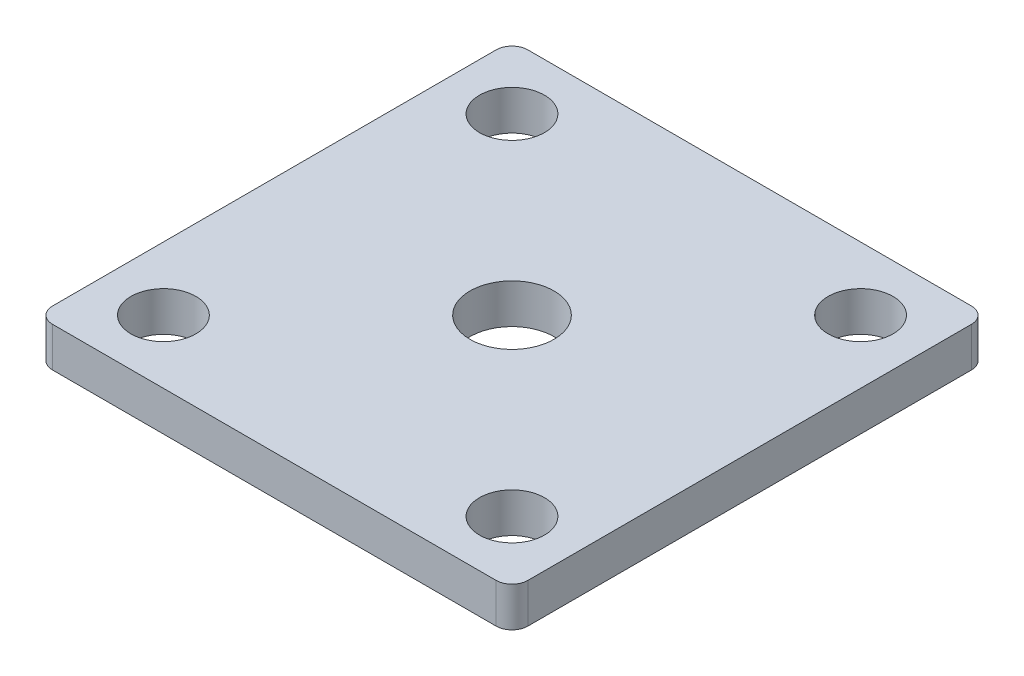
from build123d import *

# Parameters (mm, degrees)
SKETCH2_W           = 38.1
SKETCH2_H           = 38.1
SKETCH2_R           = 2.6035
SKETCH2_R_2         = 3.3655
BOSS_EXTRUDE1_DEPTH = 3.175
FILLET1_R           = 1.27


with BuildPart() as part:
    # Sketch2 → Boss-Extrude1 (new body)
    with BuildSketch(Plane(origin=(0, 0, 0), x_dir=(1, 0, 0), z_dir=(0, 1, 0))):
        Rectangle(SKETCH2_W, SKETCH2_H)
        with Locations((-13.97, 13.97)):
            Circle(SKETCH2_R, mode=Mode.SUBTRACT)
        with Locations((-13.97, -13.97)):
            Circle(SKETCH2_R, mode=Mode.SUBTRACT)
        with Locations((13.97, -13.97)):
            Circle(SKETCH2_R, mode=Mode.SUBTRACT)
        with Locations((13.97, 13.97)):
            Circle(SKETCH2_R, mode=Mode.SUBTRACT)
        Circle(SKETCH2_R_2, mode=Mode.SUBTRACT)
    extrude(amount=BOSS_EXTRUDE1_DEPTH)

    # Fillet1
    fillet1_edges = [part.edges().sort_by_distance(p)[0] for p in [
        (-19.05, 1.5875, -19.05),
        (19.05, 1.5875, -19.05),
        (19.05, 1.5875, 19.05),
        (-19.05, 1.5875, 19.05),
    ]]
    fillet(fillet1_edges, radius=FILLET1_R)


solid = part.part
